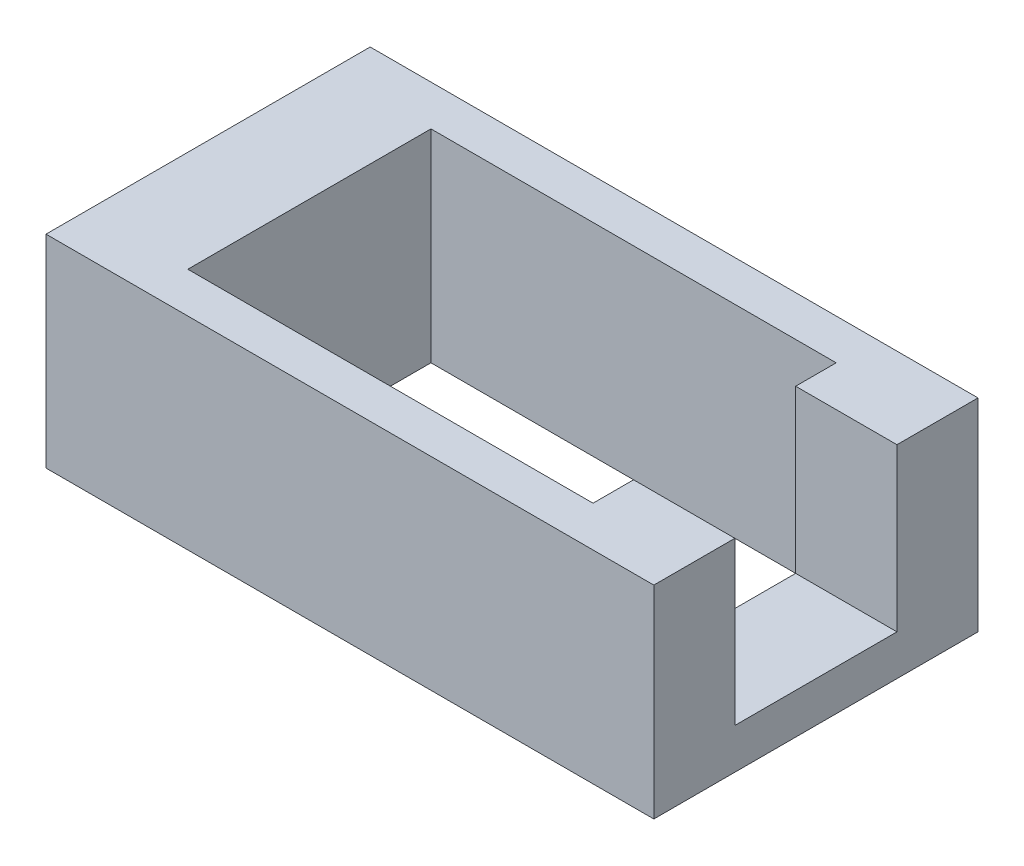
from build123d import *

# Parameters (mm, degrees)
CUT_EXTRUDE3_DEPTH           = 60
CUT_EXTRUDE5_DEPTH           = 2
CUT_EXTRUDE5_DEPTH_BACK      = 30
SKETCH9_R                    = 38
SKETCH9_R_2                  = 23
SKETCH19_W                   = 12
SKETCH19_H                   = 36.5
CUT_REVOLVE2_ANGLE           = 65
CUT_REVOLVE2_OTHER_WAY_ANGLE = 65
SKETCH21_W                   = 3.25
SKETCH21_H                   = 4
BOSS_EXTRUDE3_DEPTH          = 1.35
CIRPATTERN1_COUNT            = 5
CUT_EXTRUDE9_START           = -5
CUT_EXTRUDE9_DEPTH           = 5
SKETCH23_R                   = 10.5
CUT_EXTRUDE10_DEPTH          = 10
SKETCH24_W                   = 15
SKETCH24_H                   = 8
BOSS_EXTRUDE4_DEPTH          = 8
SKETCH26_W                   = 10
SKETCH26_H                   = 6
CUT_EXTRUDE11_DEPTH          = 10
SKETCH27_W                   = 4
SKETCH27_H                   = 5
CUT_EXTRUDE12_DEPTH          = 5
CUT_EXTRUDE14_DEPTH          = 2
CUT_EXTRUDE14_DEPTH_BACK     = 30
SKETCH29_R                   = 1
CUT_EXTRUDE15_DEPTH          = 15
FILLET1_R                    = 6
FILLET2_R                    = 8
INTERSECT1_OUTLINE_W         = 15
INTERSECT1_OUTLINE_H         = 8
INTERSECT1_OUTLINE_W_2       = 10
INTERSECT1_OUTLINE_H_2       = 6
INTERSECT1_DEPTH             = 63.427876097
INTERSECT1_START             = 13
INTERSECT1_2_OUTLINE_W       = 15
INTERSECT1_2_OUTLINE_H       = 8
INTERSECT1_2_OUTLINE_W_2     = 10
INTERSECT1_2_OUTLINE_H_2     = 6
INTERSECT1_2_DEPTH           = 12.427876097
INTERSECT1_START_2           = 55.427876097
INTERSECT1_3_OUTLINE_W       = 15
INTERSECT1_3_OUTLINE_H       = 8
INTERSECT1_3_OUTLINE_W_2     = 10
INTERSECT1_3_OUTLINE_H_2     = 6
INTERSECT1_3_DEPTH           = 3


# Read off the part's stored shape, not the designer's step: Cut-Extrude9, Intersect1
with BuildPart() as part:
    # Sketch1 → Revolve1 (revolve)
    with BuildSketch(Plane.XY, mode=Mode.PRIVATE) as revolve1_sk:
        with BuildLine():
            Line((0, 63.427876097), (32, 63.427876097))
            ThreePointArc((32, 63.427876097), (37.656854249, 61.084730346), (40, 55.427876097))
            Line((40, 55.427876097), (40, 28.846818009))
            ThreePointArc((40, 28.846818009), (38.792081772, 24.082439968), (35.460140376, 20.469057744))
            Line((35.460140376, 20.469057744), (28.539859624, 15.958818353))
            ThreePointArc((28.539859624, 15.958818353), (25.207918228, 12.345436129), (24, 7.581058088))
            Line((24, 7.581058088), (24, 3.25))
            Line((24, 3.25), (24.35, 3))
            Line((24.35, 3), (24.35, 0))
            Line((24.35, 0), (22.5, 0))
            Line((22.5, 0), (22.5, 12.5))
            ThreePointArc((22.5, 12.5), (22.353553391, 12.853553391), (22, 13))
            Line((22, 13), (0, 13))
            Line((0, 13), (0, 63.427876097))
        make_face()
    revolve(revolve1_sk.sketch.rotate(Axis((0, 0, 0), (0, 1, 0)), 90), axis=Axis((0, 0, 0), (0, 1, 0)))

    # Sketch11 → Cut-Extrude3 (cut)
    with BuildSketch(Plane(origin=(0, 13, 0), x_dir=(-1, 0, 0), z_dir=(0, -1, 0))):
        with BuildLine():
            Line((-21, 0), (21, 0))
            ThreePointArc((21, 0), (0, 21), (-21, 0))
        make_face()
    extrude(amount=-CUT_EXTRUDE3_DEPTH, mode=Mode.SUBTRACT)

    # Sketch9 → Cut-Extrude5 (cut, two sides: drawn at the far end of the back side and taken through both)
    with BuildSketch(Plane(origin=(0, 55.427876097, 0), x_dir=(1, 0, 0), z_dir=(0, 1, 0)).offset(-CUT_EXTRUDE5_DEPTH_BACK)):
        with Locations(Location((0, 0, 0), (0, 0, 270))):
            Circle(SKETCH9_R)
        with Locations(Location((0, 0, 0), (0, 0, 270))):
            Circle(SKETCH9_R_2, mode=Mode.SUBTRACT)
    extrude(amount=CUT_EXTRUDE5_DEPTH + CUT_EXTRUDE5_DEPTH_BACK, mode=Mode.SUBTRACT)

    # Sketch19 → Cut-Revolve2 (revolve, cut)
    with BuildSketch(Plane(origin=(0, 0, 0), x_dir=(0, 0, -1), z_dir=(1, 0, 0))):
        with Locations((-41.064715832, 37.177876097)):
            Rectangle(SKETCH19_W, SKETCH19_H)
    revolve(axis=Axis((0, 0, 0), (0, 1, 0)), revolution_arc=CUT_REVOLVE2_ANGLE, mode=Mode.SUBTRACT)

    # Sketch19 → Cut-Revolve2 other way (revolve, cut)
    with BuildSketch(Plane(origin=(0, 0, 0), x_dir=(0, 0, -1), z_dir=(1, 0, 0))):
        with Locations((-41.064715832, 37.177876097)):
            Rectangle(SKETCH19_W, SKETCH19_H)
    revolve(axis=Axis((0, 0, 0), (0, -1, 0)), revolution_arc=CUT_REVOLVE2_OTHER_WAY_ANGLE, mode=Mode.SUBTRACT)

    # Sketch21 → Boss-Extrude3 (add)
    with BuildSketch(Plane(origin=(0, 0, 22.5), x_dir=(-1, 0, 0), z_dir=(0, 0, -1))):
        with Locations((0, 2)):
            Rectangle(SKETCH21_W, SKETCH21_H)
    boss_extrude3 = extrude(amount=BOSS_EXTRUDE3_DEPTH)

    # CirPattern1: Boss-Extrude3 ×5 about axis
    cirpattern1_axis = Axis((0, 0, 0), (0, 1, 0))
    for i in range(1, CIRPATTERN1_COUNT):
        add(boss_extrude3.rotate(cirpattern1_axis, i * 360 / CIRPATTERN1_COUNT))

    # Cut-Extrude9 outline → Cut-Extrude9 (cut)
    with BuildSketch(Plane(origin=(0, 63.427876097, 0), x_dir=(1, 0, 0), z_dir=(0, 1, 0)).offset(CUT_EXTRUDE9_START)):
        with BuildLine():
            ThreePointArc((40, 0), (0, 40), (-40, 0))
            Line((-40, 0), (-21, 0))
            ThreePointArc((-21, 0), (0, 21), (21, 0))
            Line((21, 0), (40, 0))
        make_face()
    extrude(amount=CUT_EXTRUDE9_DEPTH, mode=Mode.SUBTRACT)

    # Sketch23 → Cut-Extrude10 (cut)
    with BuildSketch(Plane(origin=(0, 0, -40), x_dir=(-1, 0, 0), z_dir=(0, 0, -1))):
        with Locations((0, 42.137876097)):
            Circle(SKETCH23_R)
    extrude(amount=-CUT_EXTRUDE10_DEPTH, mode=Mode.SUBTRACT)

    # Sketch24 → Boss-Extrude4 (add)
    with BuildSketch(Plane(origin=(0, 58.427876097, 0), x_dir=(1, 0, 0), z_dir=(0, 1, 0))):
        with Locations((0, 30)):
            Rectangle(SKETCH24_W, SKETCH24_H)
    extrude(amount=-BOSS_EXTRUDE4_DEPTH)

    # Sketch26 → Cut-Extrude11 (cut)
    with BuildSketch(Plane(origin=(0, 58.427876097, 0), x_dir=(1, 0, 0), z_dir=(0, 1, 0))):
        with Locations((0, 30)):
            Rectangle(SKETCH26_W, SKETCH26_H)
    extrude(amount=-CUT_EXTRUDE11_DEPTH, mode=Mode.SUBTRACT)

    # Sketch27 → Cut-Extrude12 (cut)
    with BuildSketch(Plane(origin=(7.5, 0, 0), x_dir=(0, 0, -1), z_dir=(1, 0, 0))):
        with Locations((30, 53.927876097)):
            Rectangle(SKETCH27_W, SKETCH27_H)
    extrude(amount=-CUT_EXTRUDE12_DEPTH, mode=Mode.SUBTRACT)

    # Sketch28 → Cut-Extrude14 (cut, two sides: drawn at the far end of the back side and taken through both)
    with BuildSketch(Plane(origin=(0, 55.427876097, 0), x_dir=(1, 0, 0), z_dir=(0, 1, 0)).offset(-CUT_EXTRUDE14_DEPTH_BACK)):
        with BuildLine():
            Line((-22.912878475, -2), (22.912878475, -2))
            ThreePointArc((22.912878475, -2), (0, -23), (-22.912878475, -2))
        make_face()
    extrude(amount=CUT_EXTRUDE14_DEPTH + CUT_EXTRUDE14_DEPTH_BACK, mode=Mode.SUBTRACT)

    # Sketch29 → Cut-Extrude15 (cut)
    with BuildSketch(Plane(origin=(0, 0, 0), x_dir=(-1, 0, 0), z_dir=(0, 0, -1))):
        with Locations((-30.416198487, 60.927876097)):
            Circle(SKETCH29_R)
        with Locations((30.416198487, 60.927876097)):
            Circle(SKETCH29_R)
        with Locations((0, 60.927876097)):
            Circle(SKETCH29_R)
    extrude(amount=-CUT_EXTRUDE15_DEPTH, mode=Mode.SUBTRACT)

    # Fillet1
    fillet1_edges = [part.edges().sort_by_distance(p)[0] for p in [
        (21, 35.713938048, 0),
        (-21, 35.713938048, 0),
    ]]
    fillet(fillet1_edges, radius=FILLET1_R)

    # Fillet2
    fillet2_edges = [part.edges().sort_by_distance(p)[0] for p in [
        (-22.912878475, 41.427876097, 2),
        (22.912878475, 41.427876097, 2),
    ]]
    fillet(fillet2_edges, radius=FILLET2_R)

    # Intersect1 outline → Intersect1 (cut)
    # profile 1 of 2: a face of its own
    with BuildSketch(Plane(origin=(0, 0, 0), x_dir=(1, 0, 0), z_dir=(0, 1, 0))):
        with BuildLine():
            Line((-37.080992435, -15), (-40.906642577, -15))
            Line((-40.906642577, -15), (-42, -15.355253362))
            Line((-42, -15.355253362), (-42, -42))
            Line((-42, -42), (42, -42))
            Line((42, -42), (42, -15.355253362))
            Line((42, -15.355253362), (40.906642577, -15))
            Line((40.906642577, -15), (37.080992435, -15))
            ThreePointArc((37.080992435, -15), (0, 40), (-37.080992435, -15))
        make_face()
        with BuildLine():
            ThreePointArc((19.246817919, 8.4), (18.767687244, 2.713664655), (13.747727085, 0))
            Line((13.747727085, 0), (-13.747727085, 0))
            ThreePointArc((-13.747727085, 0), (-18.767687244, 2.713664655), (-19.246817919, 8.4))
            ThreePointArc((-19.246817919, 8.4), (0, 21), (19.246817919, 8.4))
        make_face(mode=Mode.SUBTRACT)
        with Locations((0, 30)):
            Rectangle(INTERSECT1_OUTLINE_W, INTERSECT1_OUTLINE_H, mode=Mode.SUBTRACT)
    # profile 2 of 2: a face of its own
    with BuildSketch(Plane(origin=(0, 0, 0), x_dir=(1, 0, 0), z_dir=(0, 1, 0))):
        with Locations((0, 30)):
            Rectangle(INTERSECT1_OUTLINE_W_2, INTERSECT1_OUTLINE_H_2)
    extrude(amount=INTERSECT1_DEPTH, mode=Mode.SUBTRACT)

    # Intersect1 2 outline → Intersect1 2 (cut)
    with BuildSketch(Plane(origin=(0, 0, 0), x_dir=(1, 0, 0), z_dir=(0, 1, 0)).offset(INTERSECT1_START)):
        with Locations((0, 30)):
            Rectangle(INTERSECT1_2_OUTLINE_W, INTERSECT1_2_OUTLINE_H)
        with Locations((0, 30)):
            Rectangle(INTERSECT1_2_OUTLINE_W_2, INTERSECT1_2_OUTLINE_H_2, mode=Mode.SUBTRACT)
    extrude(amount=INTERSECT1_2_DEPTH, mode=Mode.SUBTRACT)

    # Intersect1 3 outline → Intersect1 3 (cut)
    with BuildSketch(Plane(origin=(0, 0, 0), x_dir=(1, 0, 0), z_dir=(0, 1, 0)).offset(INTERSECT1_START_2)):
        with Locations((0, 30)):
            Rectangle(INTERSECT1_3_OUTLINE_W, INTERSECT1_3_OUTLINE_H)
        with Locations((0, 30)):
            Rectangle(INTERSECT1_3_OUTLINE_W_2, INTERSECT1_3_OUTLINE_H_2, mode=Mode.SUBTRACT)
    extrude(amount=INTERSECT1_3_DEPTH, mode=Mode.SUBTRACT)


solid = part.part
